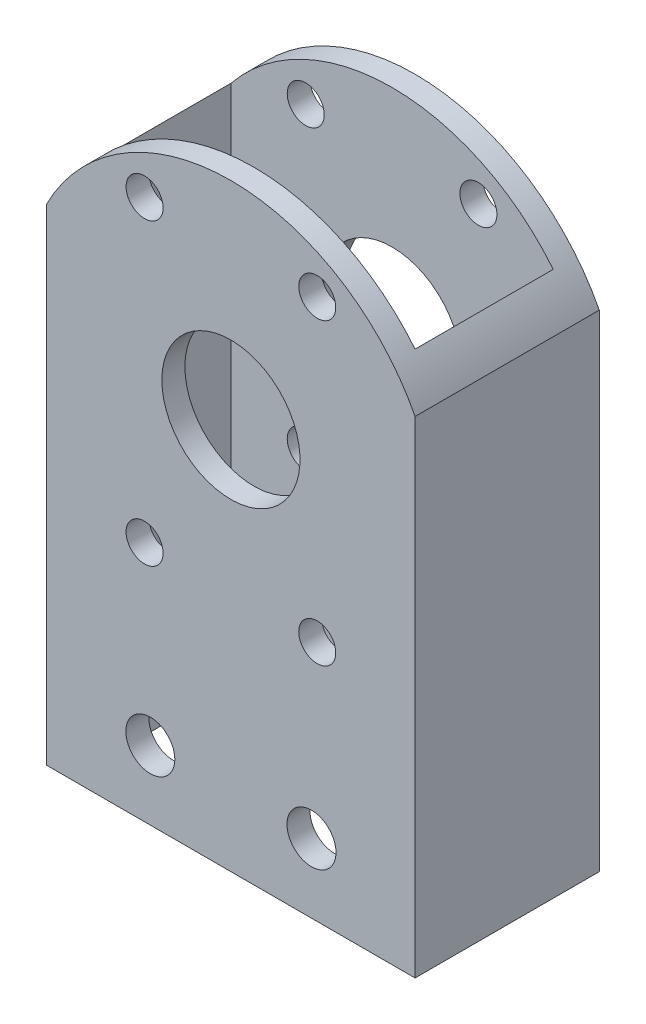
from build123d import *

# Parameters (mm, degrees)
SKETCH1_W               = 50.8
SKETCH1_H               = 25.4
SKETCH1_W_2             = 44.45
SKETCH1_H_2             = 19.05
EXTRUDE_THIN1_DEPTH     = 82.55
F_10_CLEARANCE_HOLE1_D  = 5.1054
CUT_EXTRUDE2_DEPTH      = 91.02678768
CUT_EXTRUDE2_DEPTH_BACK = 91.02678768
SKETCH7_R               = 9.525
F_1_4_CLEARANCE_HOLE2_D = 6.7564
CUT_EXTRUDE3_DEPTH      = 91.02678768


with BuildPart() as part:
    # Sketch1 → Extrude-Thin1 (new body)
    with BuildSketch(Plane(origin=(0, 0, 0), x_dir=(1, 0, 0), z_dir=(0, 1, 0))):
        Rectangle(SKETCH1_W, SKETCH1_H)
        Rectangle(SKETCH1_W_2, SKETCH1_H_2, mode=Mode.SUBTRACT)
    extrude(amount=EXTRUDE_THIN1_DEPTH)

    # #10 Clearance Hole1 (through all)
    with Locations(Plane(origin=(0, 0, -12.7), x_dir=(-1, 0, 0), z_dir=(0, 0, -1))):
        with Locations((-11.90625, 33.352770072), (-11.90625, 74.597229928), (11.90625, 74.597229928), (11.90625, 33.352770072)):
            Hole(F_10_CLEARANCE_HOLE1_D / 2)

    # Sketch7 → Cut-Extrude2 (cut, two sides: drawn at the far end of the back side and taken through both)
    with BuildSketch(Plane(origin=(0, 0, -12.7), x_dir=(-1, 0, 0), z_dir=(0, 0, -1)).offset(-CUT_EXTRUDE2_DEPTH_BACK)):
        with Locations((0, 53.975)):
            Circle(SKETCH7_R)
    extrude(amount=CUT_EXTRUDE2_DEPTH + CUT_EXTRUDE2_DEPTH_BACK, mode=Mode.SUBTRACT)

    # 1/4 Clearance Hole2 (through all)
    with Locations(Plane.XY.offset(12.7)):
        with Locations((-11.1125, 9.525), (11.1125, 9.525), (-109.171479686, 68.785430569)):
            Hole(F_1_4_CLEARANCE_HOLE2_D / 2)

    # Sketch10 → Cut-Extrude3 (cut, through all)
    with BuildSketch(Plane(origin=(0, 0, -12.7), x_dir=(-1, 0, 0), z_dir=(0, 0, -1))):
        with BuildLine():
            Line((25.4, 82.55), (0, 82.55))
            ThreePointArc((0, 82.55), (14.873790542, 78.373790542), (25.4, 67.065860361))
            Line((25.4, 67.065860361), (25.4, 82.55))
        make_face()
        with BuildLine():
            Line((-25.4, 82.55), (-25.4, 67.065860361))
            ThreePointArc((-25.4, 67.065860361), (-14.873790542, 78.373790542), (0, 82.55))
            Line((0, 82.55), (-25.4, 82.55))
        make_face()
    extrude(amount=-CUT_EXTRUDE3_DEPTH, mode=Mode.SUBTRACT)


solid = part.part
